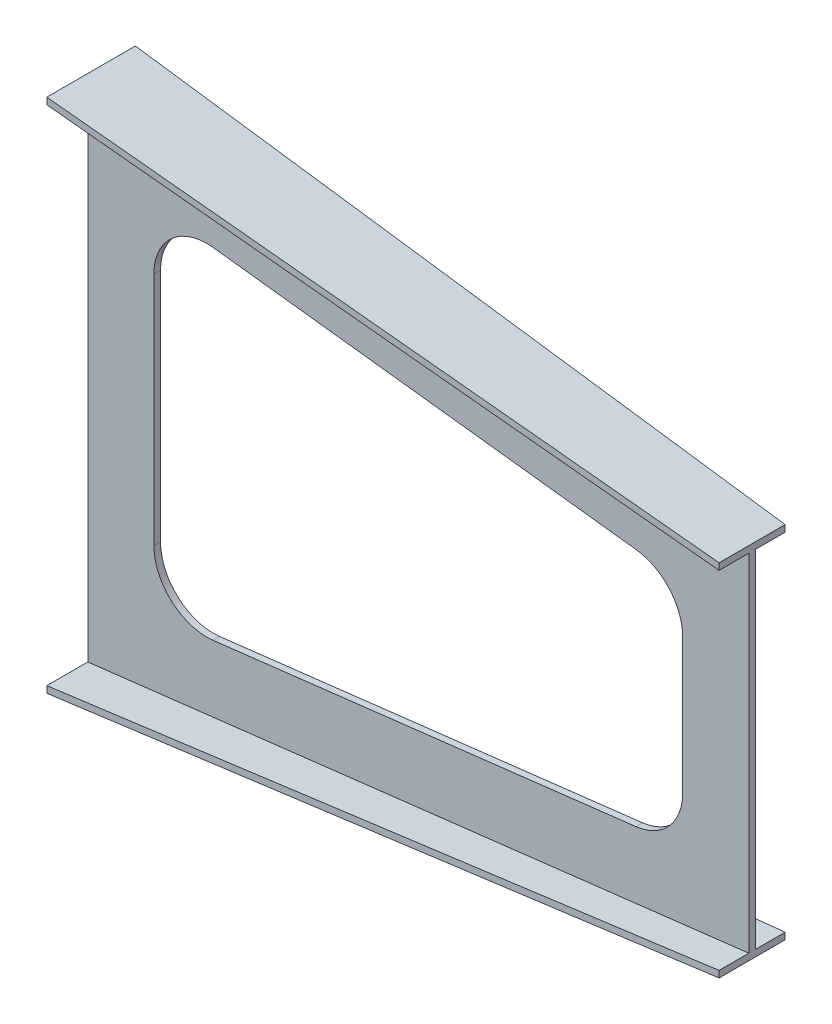
from build123d import *

# Parameters (mm, degrees)
CUT_EXTRUDE1_DEPTH = 1076.952717499


with BuildPart() as part:
    # Sketch1 → Loft l3 section 0
    with BuildSketch(Plane(origin=(0, 0, 0), x_dir=(0, 0, -1), z_dir=(1, 0, 0))):
        with BuildLine():
            Line((-72, 390.5), (62, 390.5))
            Line((62, 390.5), (62, 380.5))
            Line((62, 380.5), (0, 380.5))
            Line((0, 380.5), (0, -380.5))
            Line((0, -380.5), (62, -380.5))
            Line((62, -380.5), (62, -390.5))
            Line((62, -390.5), (-72, -390.5))
            Line((-72, -390.5), (-72, -380.5))
            Line((-72, -380.5), (-10, -380.5))
            Line((-10, -380.5), (-10, 380.5))
            Line((-10, 380.5), (-72, 380.5))
            Line((-72, 380.5), (-72, 390.5))
        make_face()
    # Sketch4 → Loft l3 section 1
    with BuildSketch(Plane(origin=(1000, 0, -1000), x_dir=(0, 0, 1), z_dir=(-1, 0, 0))):
        with BuildLine():
            Line((955, 272), (1055, 272))
            Line((1055, 272), (1055, 262))
            Line((1055, 262), (1010, 262))
            Line((1010, 262), (1010, -262))
            Line((1010, -262), (1055, -262))
            Line((1055, -262), (1055, -272))
            Line((1055, -272), (955, -272))
            Line((955, -272), (955, -262))
            Line((955, -262), (1000, -262))
            Line((1000, -262), (1000, 262))
            Line((1000, 262), (955, 262))
            Line((955, 262), (955, 272))
        make_face()
    loft()

    # Sketch6 → Cut-Extrude1 (cut, through all)
    with BuildSketch(Plane.XY.offset(10)):
        with BuildLine():
            Line((189.414132624, -257.354760439), (829.414132624, -181.514760439))
            ThreePointArc((829.414132624, -181.514760439), (879.80439202, -155.206605151), (900, -102.070603278))
            Line((900, -102.070603278), (900, 102.070603278))
            ThreePointArc((900, 102.070603278), (879.80439202, 155.206605151), (829.414132624, 181.514760439))
            Line((829.414132624, 181.514760439), (189.414132624, 257.354760439))
            ThreePointArc((189.414132624, 257.354760439), (126.863998127, 237.714995299), (100, 177.910603278))
            Line((100, 177.910603278), (100, -177.910603278))
            ThreePointArc((100, -177.910603278), (126.863998127, -237.714995299), (189.414132624, -257.354760439))
        make_face()
    extrude(amount=-CUT_EXTRUDE1_DEPTH, mode=Mode.SUBTRACT)


solid = part.part
